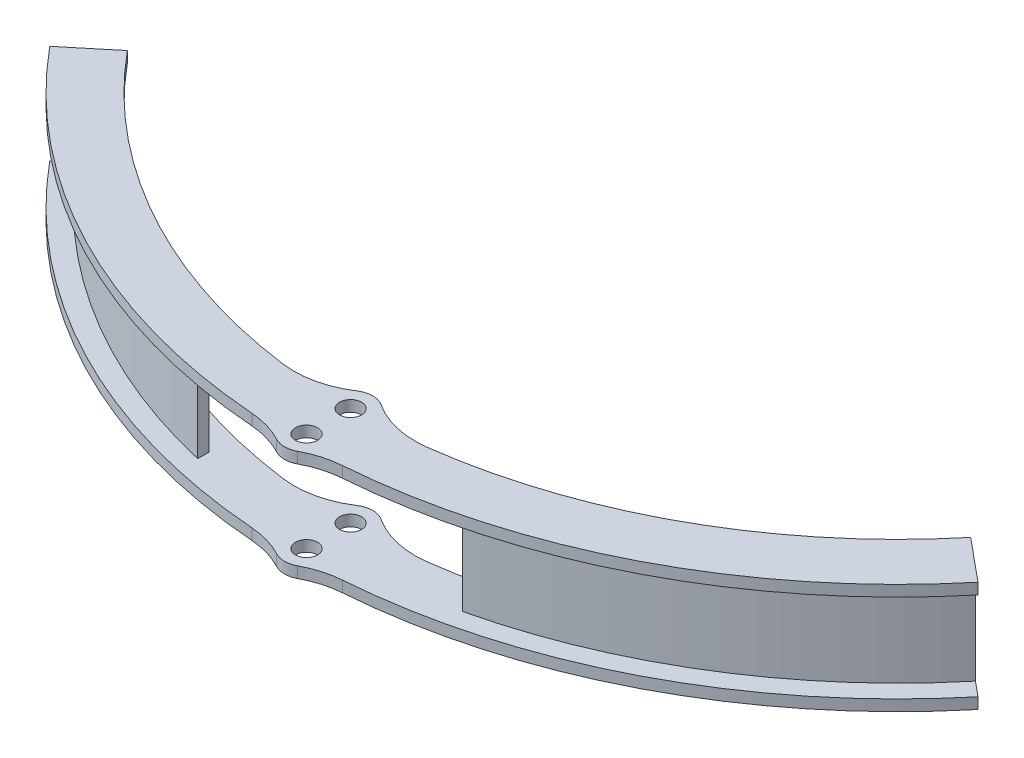
from build123d import *

# Parameters (mm, degrees)
SKETCH1_R           = 3.175
BOSS_EXTRUDE1_DEPTH = 3.175
BOSS_EXTRUDE2_DEPTH = 25.4
FILLET1_R           = 25.4
SKETCH4_W           = 38.1
SKETCH4_H           = 25.4
CUT_EXTRUDE1_DEPTH  = 254


# Read off the part's stored shape, not the designer's step: Boss-Extrude2
with BuildPart() as part:
    # Sketch1 → Boss-Extrude1 (new body)
    with BuildSketch(Plane(origin=(0, 0, 0), x_dir=(1, 0, 0), z_dir=(0, 1, 0))):
        with BuildLine():
            ThreePointArc((-133.675170743, 47.031446414), (-76.370132102, 1.839200867), (-5.549575239, -15.786213647))
            ThreePointArc((-5.549575239, -15.786213647), (0, -19.05), (5.549575239, -15.786213647))
            ThreePointArc((5.549575239, -15.786213647), (76.370132102, 1.839200867), (133.675170743, 47.031446414))
            Line((133.675170743, 47.031446414), (121.442816173, 57.15))
            ThreePointArc((121.442816173, 57.15), (69.968192782, 16.382290944), (6.348711382, 0.127921031))
            ThreePointArc((6.348711382, 0.127921031), (0, 6.35), (-6.348711382, 0.127921031))
            ThreePointArc((-6.348711382, 0.127921031), (-69.968192782, 16.382290944), (-121.442816173, 57.15))
            Line((-121.442816173, 57.15), (-133.675170743, 47.031446414))
        make_face()
        with Locations(Location((0, -12.7, 0), (0, 0, 270))):
            Circle(SKETCH1_R, mode=Mode.SUBTRACT)
        with Locations(Location((0, 0, 0), (0, 0, 270))):
            Circle(SKETCH1_R, mode=Mode.SUBTRACT)
    boss_extrude1 = extrude(amount=BOSS_EXTRUDE1_DEPTH)

    # Boss-Extrude2 outline → Boss-Extrude2 (add)
    with BuildSketch(Plane(origin=(0, 3.175, 0), x_dir=(1, 0, 0), z_dir=(0, 1, 0))):
        with BuildLine():
            ThreePointArc((2.08529156, -10.30580199), (72.444780746, 6.111748406), (129.393846644, 50.572940169))
            Line((129.393846644, 50.572940169), (126.947375729, 52.596650886))
            ThreePointArc((126.947375729, 52.596650886), (0, -7.14375), (-126.947375729, 52.596650886))
            Line((-126.947375729, 52.596650886), (-129.393846644, 50.572940169))
            ThreePointArc((-129.393846644, 50.572940169), (-72.444780746, 6.111748406), (-2.08529156, -10.30580199))
            ThreePointArc((-2.08529156, -10.30580199), (0, -9.525), (2.08529156, -10.30580199))
        make_face()
    extrude(amount=BOSS_EXTRUDE2_DEPTH)

    # Mirror1: Boss-Extrude1 across plane
    add(boss_extrude1.mirror(Plane(origin=(0, 15.875, 0), x_dir=(0, 0, 1), z_dir=(0, -1, 0))))

    # Fillet1
    fillet1_edges = [part.edges().sort_by_distance(p)[0] for p in [
        (-5.549575239, 1.5875, 15.786213647),
        (-6.348711382, 1.5875, -0.127921031),
        (6.348711382, 1.5875, -0.127921031),
        (5.549575239, 1.5875, 15.786213647),
        (5.549575239, 30.1625, 15.786213647),
        (-5.549575239, 30.1625, 15.786213647),
        (-6.348711382, 30.1625, -0.127921031),
        (6.348711382, 30.1625, -0.127921031),
    ]]
    fillet(fillet1_edges, radius=FILLET1_R)

    # Sketch4 → Cut-Extrude1 (cut)
    with BuildSketch(Plane.XY.offset(-52.596650886)):
        with Locations((-19.05, 15.875)):
            Rectangle(SKETCH4_W, SKETCH4_H)
        with Locations((19.05, 15.875)):
            Rectangle(SKETCH4_W, SKETCH4_H)
    extrude(amount=CUT_EXTRUDE1_DEPTH, mode=Mode.SUBTRACT)


solid = part.part
